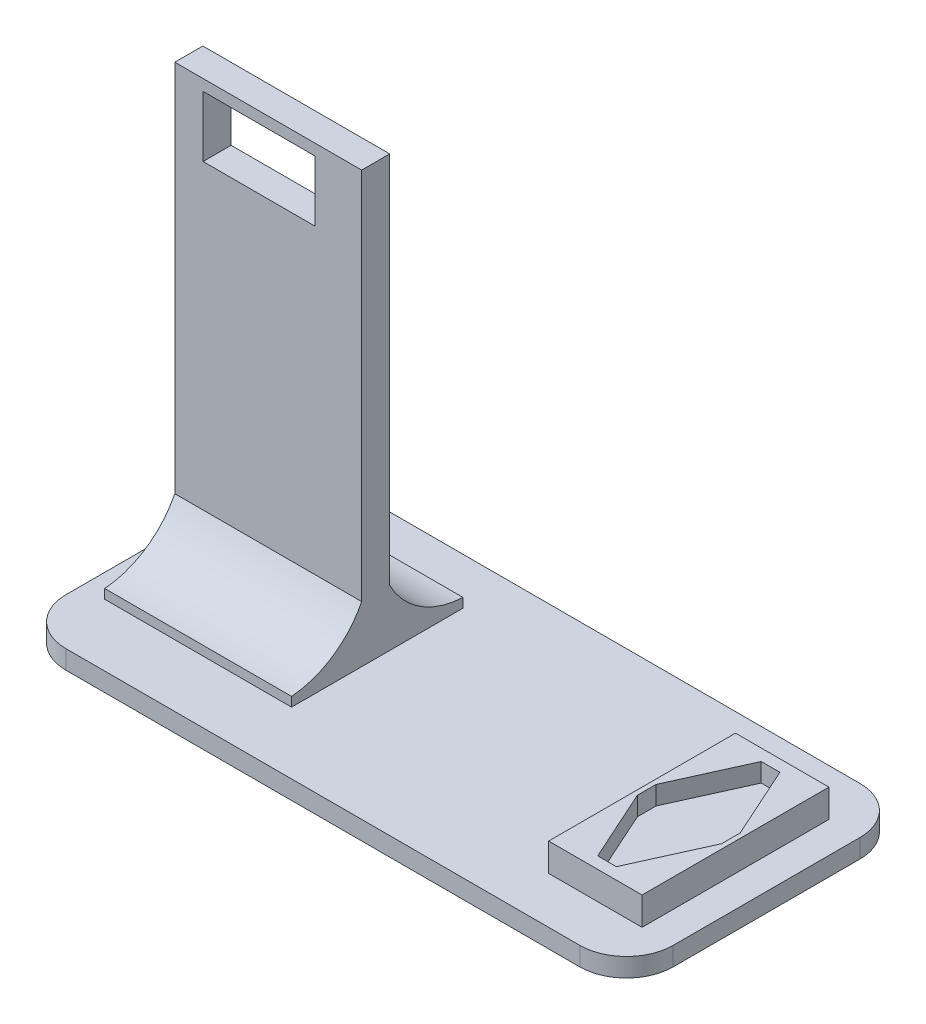
from build123d import *

# Parameters (mm, degrees)
BOSS_EXTRUDE3_DEPTH = 4
SKETCH2_W           = 40
SKETCH2_H           = 36.696145016
SKETCH2_W_2         = 20
SKETCH2_H_2         = 40
BOSS_EXTRUDE4_DEPTH = 2
LOFT8_START         = -60
LOFT8_DEPTH         = 40
SKETCH10_W          = 24
SKETCH10_H          = 13
CUT_EXTRUDE1_DEPTH  = 6
SKETCH11_W          = 20
SKETCH11_H          = 40
BOSS_EXTRUDE5_DEPTH = 4


# Read off the part's stored shape, not the designer's step: Loft8
with BuildPart() as part:
    # Sketch1 → Boss-Extrude3 (new body)
    with BuildSketch(Plane(origin=(0, 0, 0), x_dir=(1, 0, 0), z_dir=(0, 1, 0))):
        with BuildLine():
            Line((-55, -30), (55, -30))
            ThreePointArc((55, -30), (62.071067812, -27.071067812), (65, -20))
            Line((65, -20), (65, 20))
            ThreePointArc((65, 20), (62.071067812, 27.071067812), (55, 30))
            Line((55, 30), (-55, 30))
            ThreePointArc((-55, 30), (-62.071067812, 27.071067812), (-65, 20))
            Line((-65, 20), (-65, -20))
            ThreePointArc((-65, -20), (-62.071067812, -27.071067812), (-55, -30))
        make_face()
    extrude(amount=-BOSS_EXTRUDE3_DEPTH)

    # Sketch2 → Boss-Extrude4 (add)
    with BuildSketch(Plane(origin=(0, 2, 0), x_dir=(1, 0, 0), z_dir=(0, 1, 0))):
        with Locations((-40, 1.651927492)):
            Rectangle(SKETCH2_W, SKETCH2_H)
        with Locations((48.333333333, 0)):
            Rectangle(SKETCH2_W_2, SKETCH2_H_2)
    extrude(amount=-BOSS_EXTRUDE4_DEPTH)

    # Loft8 outline → Loft8 (add)
    with BuildSketch(Plane.YZ.offset(LOFT8_START)):
        with BuildLine():
            Line((92.073834687, -4.303854984), (92.073834687, 1.696145016))
            Line((92.073834687, 1.696145016), (12.073834687, 1.696145016))
            ThreePointArc((12.073834687, 1.696145016), (5.064409277, 7.871430337), (2, 16.696145016))
            Line((2, 16.696145016), (2, -20))
            ThreePointArc((2, -20), (4.932872822, -10.801545174), (12.073834687, -4.303854984))
            Line((12.073834687, -4.303854984), (92.073834687, -4.303854984))
        make_face()
    extrude(amount=LOFT8_DEPTH)

    # Sketch10 → Cut-Extrude1 (cut)
    with BuildSketch(Plane.XY.offset(1.696145016)):
        with Locations((-41.946023743, 83.186487073)):
            Rectangle(SKETCH10_W, SKETCH10_H)
    extrude(amount=-CUT_EXTRUDE1_DEPTH, mode=Mode.SUBTRACT)

    # Sketch11 → Boss-Extrude5 (add)
    # profile 1 of 5: a face of its own
    with BuildSketch(Plane(origin=(0, 2, 0), x_dir=(1, 0, 0), z_dir=(0, 1, 0))):
        with Locations((48.333333333, 0)):
            Rectangle(SKETCH11_W, SKETCH11_H)
        Polygon((57.333333333, 2), (57.333333333, 0), (57.333333333, -2), (57.333333333, -17.5), (50.333333333, -17.5), (48.333333333, -17.5), (46.333333333, -17.5), (39.333333333, -17.5), (39.333333333, -2), (39.333333333, 0), (39.333333333, 2), (39.333333333, 17.5), (46.333333333, 17.5), (48.333333333, 17.5), (50.333333333, 17.5), (57.333333333, 17.5), align=None, mode=Mode.SUBTRACT)
    # profile 2 of 5: a face of its own
    with BuildSketch(Plane(origin=(0, 2, 0), x_dir=(1, 0, 0), z_dir=(0, 1, 0))):
        Polygon((50.333333333, 17.5), (57.333333333, 2), (57.333333333, 17.5), align=None)
    # profile 3 of 5: a face of its own
    with BuildSketch(Plane(origin=(0, 2, 0), x_dir=(1, 0, 0), z_dir=(0, 1, 0))):
        Polygon((39.333333333, 2), (46.333333333, 17.5), (39.333333333, 17.5), align=None)
    # profile 4 of 5: a face of its own
    with BuildSketch(Plane(origin=(0, 2, 0), x_dir=(1, 0, 0), z_dir=(0, 1, 0))):
        Polygon((39.333333333, -17.5), (46.333333333, -17.5), (39.333333333, -2), align=None)
    # profile 5 of 5: a face of its own
    with BuildSketch(Plane(origin=(0, 2, 0), x_dir=(1, 0, 0), z_dir=(0, 1, 0))):
        Polygon((57.333333333, -17.5), (57.333333333, -2), (50.333333333, -17.5), align=None)
    extrude(amount=BOSS_EXTRUDE5_DEPTH)


solid = part.part
